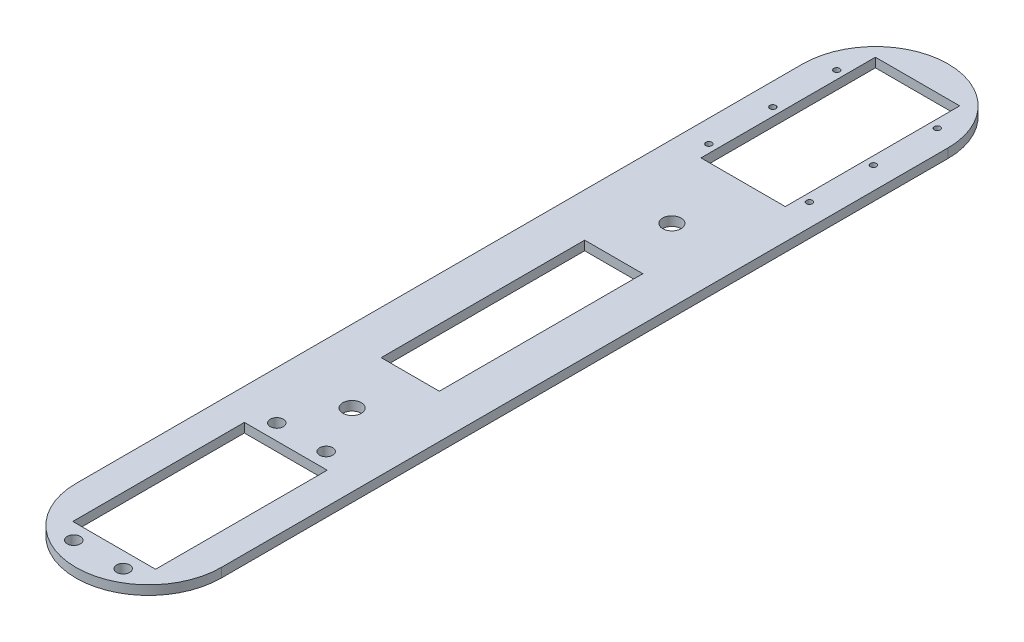
from build123d import *

# Parameters (mm, degrees)
SKETCH2_W           = 50
SKETCH2_H           = 300
BOSS_EXTRUDE1_DEPTH = 3.175
SKETCH3_R           = 1.025
SKETCH3_R_2         = 2.25
SKETCH3_W           = 29
SKETCH3_H           = 60
SKETCH3_W_2         = 28.48
SKETCH3_H_2         = 59.03
CUT_EXTRUDE1_DEPTH  = 6.35
CUT_EXTRUDE2_DEPTH  = 6.35
SKETCH5_R           = 3.175
SKETCH5_W           = 20
SKETCH5_H           = 70
CUT_EXTRUDE3_DEPTH  = 6.35


with BuildPart() as part:
    # Sketch2 → Boss-Extrude1 (new body)
    with BuildSketch(Plane(origin=(0, 0, 0), x_dir=(1, 0, 0), z_dir=(0, 1, 0))):
        with Locations((25, -150)):
            Rectangle(SKETCH2_W, SKETCH2_H)
    extrude(amount=BOSS_EXTRUDE1_DEPTH)

    # Sketch3 → Cut-Extrude1 (cut)
    with BuildSketch(Plane(origin=(0, 3.175, 0), x_dir=(1, 0, 0), z_dir=(0, 1, 0))):
        with Locations((7.7, -21)):
            Circle(SKETCH3_R)
        with Locations((7.7, -43)):
            Circle(SKETCH3_R)
        with Locations((7.7, -65)):
            Circle(SKETCH3_R)
        with Locations((42.3, -65)):
            Circle(SKETCH3_R)
        with Locations((42.3, -43)):
            Circle(SKETCH3_R)
        with Locations((42.3, -21)):
            Circle(SKETCH3_R)
        with Locations((16.5, -292.24)):
            Circle(SKETCH3_R_2)
        with Locations((33.5, -292.24)):
            Circle(SKETCH3_R_2)
        with Locations((16.5, -222.41)):
            Circle(SKETCH3_R_2)
        with Locations((33.5, -222.41)):
            Circle(SKETCH3_R_2)
        with Locations((25, -40.5)):
            Rectangle(SKETCH3_W, SKETCH3_H)
        with Locations((25, -257.325)):
            Rectangle(SKETCH3_W_2, SKETCH3_H_2)
    extrude(amount=-CUT_EXTRUDE1_DEPTH, mode=Mode.SUBTRACT)

    # Sketch4 → Cut-Extrude2 (cut)
    with BuildSketch(Plane(origin=(0, 3.175, 0), x_dir=(1, 0, 0), z_dir=(0, 1, 0))):
        with BuildLine():
            Line((0, 0), (0, -25))
            ThreePointArc((0, -25), (7.32233047, -7.32233047), (25, 0))
            Line((25, 0), (0, 0))
        make_face()
        with BuildLine():
            ThreePointArc((25, 0), (42.67766953, -7.32233047), (50, -25))
            Line((50, -25), (50, 0))
            Line((50, 0), (25, 0))
        make_face()
        with BuildLine():
            ThreePointArc((25, -300), (7.32233047, -292.67766953), (0, -275))
            Line((0, -275), (0, -300))
            Line((0, -300), (25, -300))
        make_face()
        with BuildLine():
            Line((50, -300), (50, -275))
            ThreePointArc((50, -275), (42.67766953, -292.67766953), (25, -300))
            Line((25, -300), (50, -300))
        make_face()
    extrude(amount=-CUT_EXTRUDE2_DEPTH, mode=Mode.SUBTRACT)

    # Sketch5 → Cut-Extrude3 (cut)
    with BuildSketch(Plane.XZ):
        with Locations((25, 205)):
            Circle(SKETCH5_R)
        with Locations((25, 95)):
            Circle(SKETCH5_R)
        with Locations((25, 150)):
            Rectangle(SKETCH5_W, SKETCH5_H)
    extrude(amount=-CUT_EXTRUDE3_DEPTH, mode=Mode.SUBTRACT)


solid = part.part
